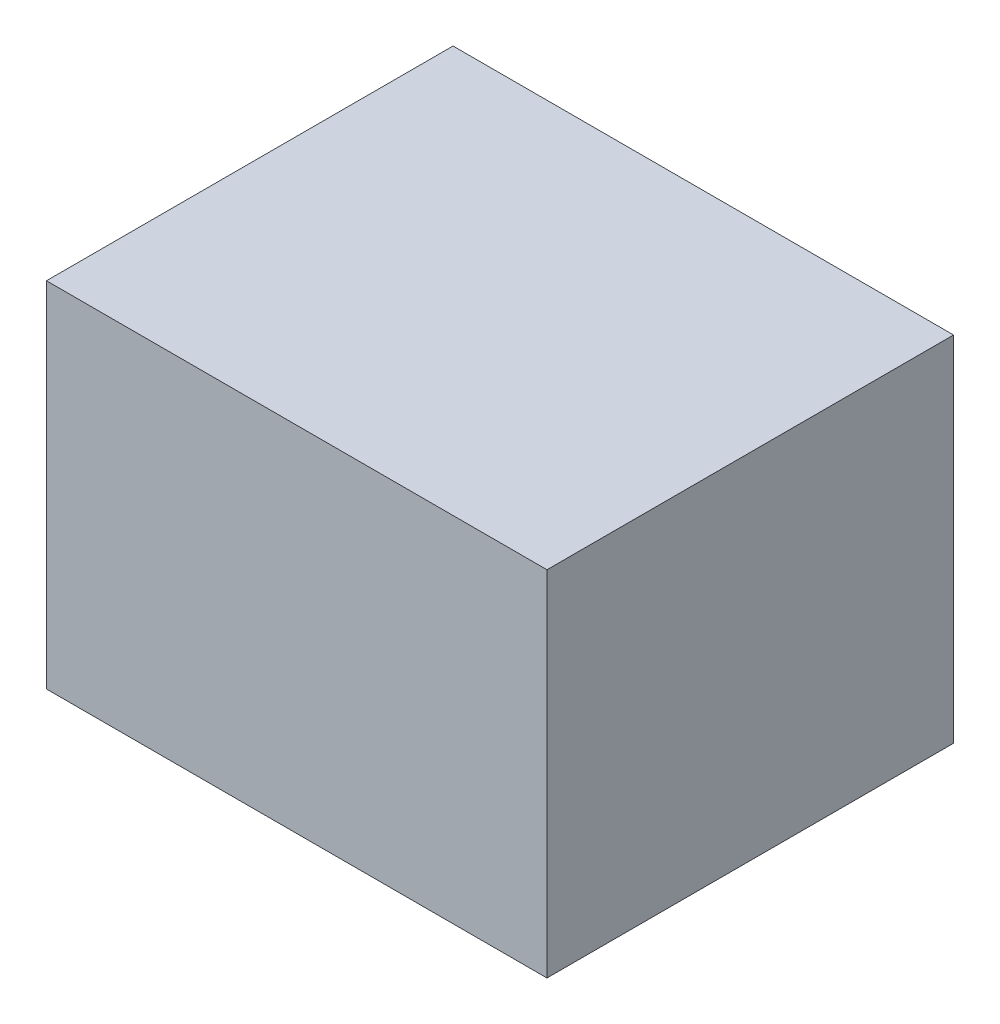
from build123d import *

# Parameters (mm, degrees)
SKETCH1_W           = 36.453071334
SKETCH1_H           = 29.61270878
BOSS_EXTRUDE1_DEPTH = 25.750300868


with BuildPart() as part:
    # Sketch1 → Boss-Extrude1 (new body)
    with BuildSketch(Plane(origin=(0, 0, 0), x_dir=(1, 0, 0), z_dir=(0, 1, 0))):
        with Locations((18.226535667, 14.80635439)):
            Rectangle(SKETCH1_W, SKETCH1_H)
    extrude(amount=BOSS_EXTRUDE1_DEPTH)


solid = part.part
